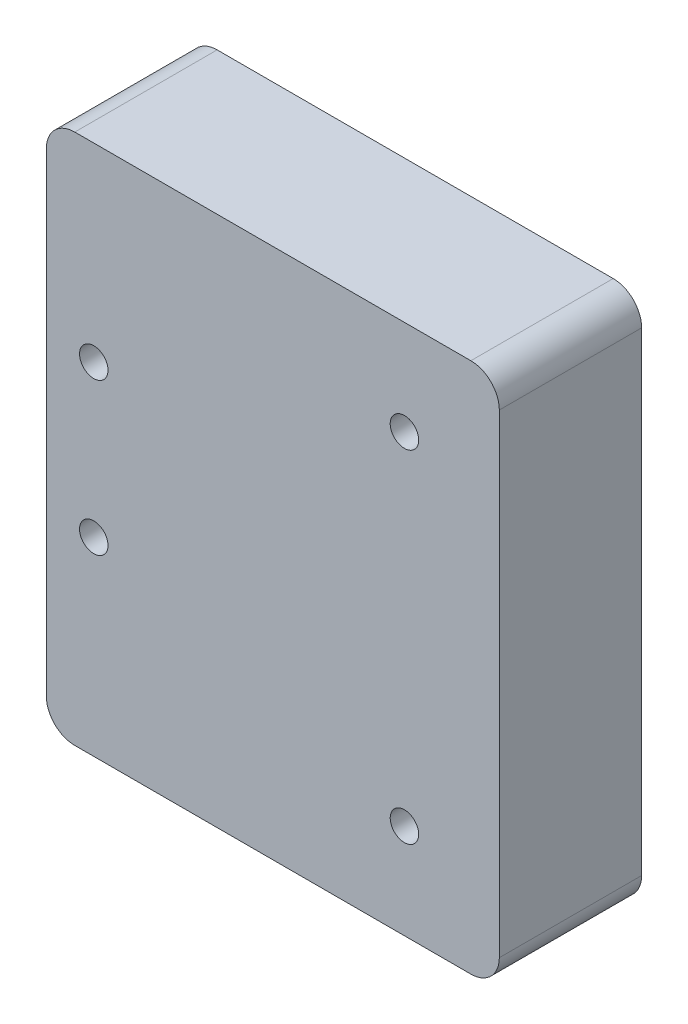
from build123d import *

# Parameters (mm, degrees)
ESQUISSE1_W             = 60
ESQUISSE1_H             = 60
BOSS_EXTRU_1_DEPTH      = 15
ESQUISSE2_R             = 4.3
ESQUISSE2_R_2           = 5
ENL_V_MAT_EXTRU_1_DEPTH = 8
ESQUISSE4_W             = 12.260138716
ESQUISSE4_H             = 60
ENL_V_MAT_EXTRU_2_DEPTH = 87.168439698
ESQUISSE5_R             = 4
ENL_V_MAT_EXTRU_3_DEPTH = 8
ESQUISSE6_W             = 47.739861284
ESQUISSE6_H             = 4.016031869
ENL_V_MAT_EXTRU_4_DEPTH = 79.128703787
CONG_1_R                = 3
ESQUISSE7_R             = 1.5
ENL_V_MAT_EXTRU_5_DEPTH = 5


with BuildPart() as part:
    # Esquisse1 → Boss.-Extru.1 (new body)
    with BuildSketch(Plane.XY):
        with Locations((30, 30)):
            Rectangle(ESQUISSE1_W, ESQUISSE1_H)
    extrude(amount=BOSS_EXTRU_1_DEPTH)

    # Esquisse2 → Enlèv. mat.-Extru.1 (cut)
    with BuildSketch(Plane.XY):
        with Locations((10, 34.48658512)):
            Circle(ESQUISSE2_R)
        with Locations((10, 18.18658512)):
            Circle(ESQUISSE2_R)
        with Locations((24.644968419, 26.33658512)):
            Circle(ESQUISSE2_R_2)
    extrude(amount=ENL_V_MAT_EXTRU_1_DEPTH, mode=Mode.SUBTRACT)

    # Esquisse4 → Enlèv. mat.-Extru.2 (cut, through all)
    with BuildSketch(Plane.XY):
        with Locations((53.869930642, 30)):
            Rectangle(ESQUISSE4_W, ESQUISSE4_H)
    extrude(amount=ENL_V_MAT_EXTRU_2_DEPTH, mode=Mode.SUBTRACT)

    # Esquisse5 → Enlèv. mat.-Extru.3 (cut)
    with BuildSketch(Plane(origin=(0, 0, 0), x_dir=(0, 0, -1), z_dir=(1, 0, 0))):
        with Locations((-7.779969549, 8)):
            Circle(ESQUISSE5_R)
        with Locations((-7.779969549, 48)):
            Circle(ESQUISSE5_R)
    extrude(amount=ENL_V_MAT_EXTRU_3_DEPTH, mode=Mode.SUBTRACT)

    # Esquisse6 → Enlèv. mat.-Extru.4 (cut, through all)
    with BuildSketch(Plane(origin=(0, 0, 0), x_dir=(-1, 0, 0), z_dir=(0, 0, -1))):
        with Locations((-23.869930642, 57.991984066)):
            Rectangle(ESQUISSE6_W, ESQUISSE6_H)
    extrude(amount=-ENL_V_MAT_EXTRU_4_DEPTH, mode=Mode.SUBTRACT)

    # Congé1
    cong_1_edges = [part.edges().sort_by_distance(p)[0] for p in [
        (47.739861284, 0, 7.5),
        (47.739861284, 55.983968131, 7.5),
        (0, 55.983968131, 7.5),
        (0, 0, 7.5),
    ]]
    fillet(cong_1_edges, radius=CONG_1_R)

    # Esquisse7 → Enlèv. mat.-Extru.5 (cut)
    with BuildSketch(Plane.XY.offset(15)):
        with Locations((37.739861284, 45.983968131)):
            Circle(ESQUISSE7_R)
        with Locations((37.739861284, 10)):
            Circle(ESQUISSE7_R)
        with Locations((5, 20)):
            Circle(ESQUISSE7_R)
        with Locations((5, 35.983968131)):
            Circle(ESQUISSE7_R)
    extrude(amount=-ENL_V_MAT_EXTRU_5_DEPTH, mode=Mode.SUBTRACT)


solid = part.part
